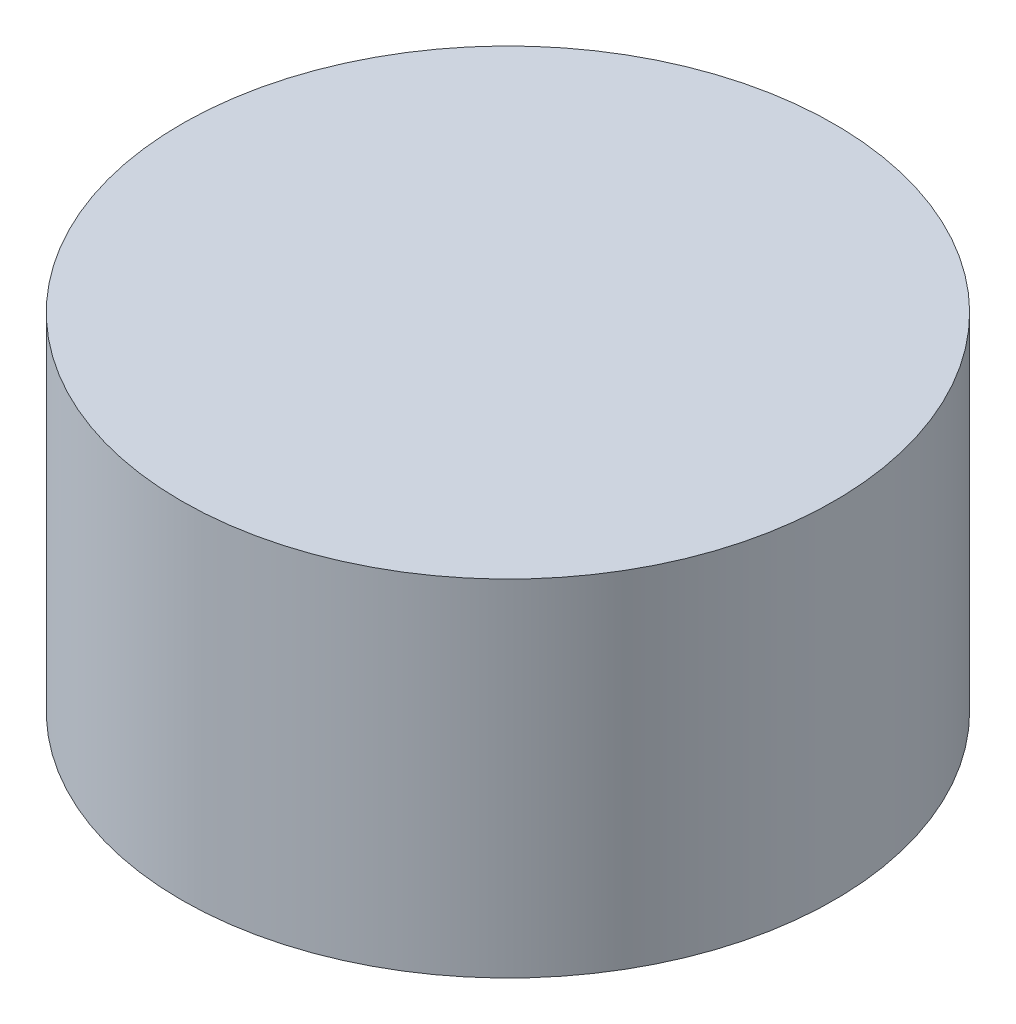
from build123d import *

# Parameters (mm, degrees)
SKETCH1_R           = 30
BOSS_EXTRUDE1_DEPTH = 31.75
CIRPATTERN1_COUNT   = 3
CUT_EXTRUDE1_DEPTH  = 22.225


with BuildPart() as part:
    # Sketch1 → Boss-Extrude1 (new body)
    with BuildSketch(Plane(origin=(0, 0, 0), x_dir=(1, 0, 0), z_dir=(0, 1, 0))):
        Circle(SKETCH1_R)
    extrude(amount=BOSS_EXTRUDE1_DEPTH)

    # Sketch3 → Cut-Revolve7 (revolve, cut)
    with BuildSketch(Plane.XZ):
        with BuildLine():
            Line((2.5019, 18), (-2.5019, 18))
            ThreePointArc((-2.5019, 18), (0, 15.4981), (2.5019, 18))
        make_face()
    cut_revolve7 = revolve(axis=Axis((3.292813159, 0, 18), (-1, 0, 0)), mode=Mode.SUBTRACT)

    # CirPattern1: Cut-Revolve7 ×3 about axis
    cirpattern1_axis = Axis((0, 0, 0), (0, 1, 0))
    for i in range(1, CIRPATTERN1_COUNT):
        add(cut_revolve7.rotate(cirpattern1_axis, i * 360 / CIRPATTERN1_COUNT), mode=Mode.SUBTRACT)

    # Sketch5 → Cut-Extrude1 (cut)
    with BuildSketch(Plane.XZ):
        with BuildLine():
            Line((9, -15), (9, 0))
            ThreePointArc((9, 0), (0, 9), (-9, 0))
            Line((-9, 0), (-9, -15))
            Line((-9, -15), (-18, -24))
            ThreePointArc((-18, -24), (0, -30), (18, -24))
            Line((18, -24), (9, -15))
        make_face()
    extrude(amount=-CUT_EXTRUDE1_DEPTH, mode=Mode.SUBTRACT)


solid = part.part
